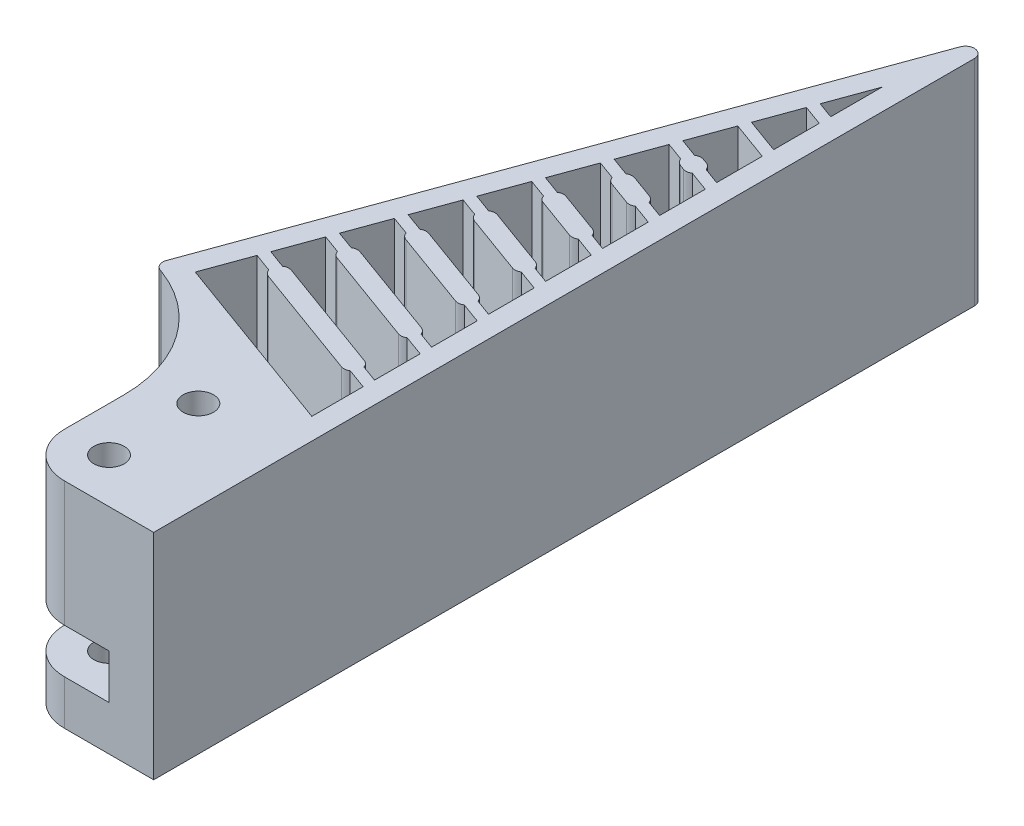
from build123d import *

# Parameters (mm, degrees)
SKETCH_1_R          = 1.7
EXTRUDE_1_DEPTH     = 24
CUT_EXTRUDE_START   = -5
SKETCH_2_R          = 1.7
CUT_EXTRUDE_1_DEPTH = 5
FILLET_1_R          = 1
FILLET_2_R          = 15


with BuildPart() as part:
    # 草图1 → 凸台-拉伸1 (new body)
    with BuildSketch(Plane(origin=(0, 0, 0), x_dir=(1, 0, 0), z_dir=(0, 1, 0))):
        with BuildLine():
            Line((-5, 17.140740034), (-5, 0))
            ThreePointArc((-5, 0), (-3.535533906, -3.535533906), (0, -5))
            Line((0, -5), (10, -5))
            Line((10, -5), (10, 92.570484452))
            Line((10, 92.570484452), (-15.997319233, 21.143436891))
            Line((-15.997319233, 21.143436891), (-5, 17.140740034))
        make_face()
        with Locations(Location((0, 0, 0), (0, 0, 270))):
            Circle(SKETCH_1_R, mode=Mode.SUBTRACT)
        with Locations(Location((0, 10, 0), (0, 0, 270))):
            Circle(SKETCH_1_R, mode=Mode.SUBTRACT)
        with BuildLine():
            Line((7.6, 15.108741736), (-12.9212086, 22.577850837))
            Line((-12.9212086, 22.577850837), (-11.074299826, 27.65219099))
            Line((-11.074299826, 27.65219099), (-9.00697606, 26.899746674))
            ThreePointArc((-9.00697606, 26.899746674), (-8.776165309, 26.502415559), (-8.392030021, 26.250253511))
            Line((-8.392030021, 26.250253511), (4.438901994, 21.58017618))
            ThreePointArc((4.438901994, 21.58017618), (4.895253337, 21.526426111), (5.327464148, 21.682437114))
            Line((5.327464148, 21.682437114), (7.6, 20.855301707))
            Line((7.6, 20.855301707), (7.6, 15.108741736))
        make_face(mode=Mode.SUBTRACT)
        with BuildLine():
            ThreePointArc((5.73788832, 22.810068259), (5.507077569, 23.207399374), (5.122942281, 23.459561422))
            Line((5.122942281, 23.459561422), (-7.707989734, 28.129638753))
            ThreePointArc((-7.707989734, 28.129638753), (-8.164341077, 28.183388821), (-8.596551888, 28.027377819))
            Line((-8.596551888, 28.027377819), (-10.663875654, 28.779822134))
            Line((-10.663875654, 28.779822134), (-9.022178966, 33.290346714))
            Line((-9.022178966, 33.290346714), (-6.9548552, 32.537902399))
            ThreePointArc((-6.9548552, 32.537902399), (-6.724044449, 32.140571284), (-6.339909161, 31.888409236))
            Line((-6.339909161, 31.888409236), (4.438901994, 27.965242815))
            ThreePointArc((4.438901994, 27.965242815), (4.895253337, 27.911492746), (5.327464148, 28.067503748))
            Line((5.327464148, 28.067503748), (7.6, 27.240368342))
            Line((7.6, 27.240368342), (7.6, 22.132315034))
            Line((7.6, 22.132315034), (5.73788832, 22.810068259))
        make_face(mode=Mode.SUBTRACT)
        with BuildLine():
            ThreePointArc((5.73788832, 29.195134893), (5.507077569, 29.592466009), (5.122942281, 29.844628056))
            Line((5.122942281, 29.844628056), (-5.655868874, 33.767794478))
            ThreePointArc((-5.655868874, 33.767794478), (-6.112220217, 33.821544546), (-6.544431028, 33.665533544))
            Line((-6.544431028, 33.665533544), (-8.611754794, 34.417977859))
            Line((-8.611754794, 34.417977859), (-6.970058106, 38.928502439))
            Line((-6.970058106, 38.928502439), (-4.90273434, 38.176058124))
            ThreePointArc((-4.90273434, 38.176058124), (-4.671923589, 37.778727008), (-4.287788301, 37.526564961))
            Line((-4.287788301, 37.526564961), (4.438901994, 34.35030945))
            ThreePointArc((4.438901994, 34.35030945), (4.895253337, 34.296559381), (5.327464148, 34.452570383))
            Line((5.327464148, 34.452570383), (7.6, 33.625434977))
            Line((7.6, 33.625434977), (7.6, 28.517381669))
            Line((7.6, 28.517381669), (5.73788832, 29.195134893))
        make_face(mode=Mode.SUBTRACT)
        with BuildLine():
            ThreePointArc((5.73788832, 35.580201528), (5.507077569, 35.977532644), (5.122942281, 36.229694691))
            Line((5.122942281, 36.229694691), (-3.603748014, 39.405950202))
            ThreePointArc((-3.603748014, 39.405950202), (-4.060099357, 39.459700271), (-4.492310168, 39.303689269))
            Line((-4.492310168, 39.303689269), (-6.559633934, 40.056133584))
            Line((-6.559633934, 40.056133584), (-4.917937246, 44.566658164))
            Line((-4.917937246, 44.566658164), (-2.85061348, 43.814213848))
            ThreePointArc((-2.85061348, 43.814213848), (-2.619802729, 43.416882733), (-2.235667441, 43.164720685))
            Line((-2.235667441, 43.164720685), (4.438901994, 40.735376085))
            ThreePointArc((4.438901994, 40.735376085), (4.895253337, 40.681626016), (5.327464148, 40.837637018))
            Line((5.327464148, 40.837637018), (7.6, 40.010501612))
            Line((7.6, 40.010501612), (7.6, 34.902448304))
            Line((7.6, 34.902448304), (5.73788832, 35.580201528))
        make_face(mode=Mode.SUBTRACT)
        with BuildLine():
            ThreePointArc((5.73788832, 41.965268163), (5.507077569, 42.362599278), (5.122942281, 42.614761326))
            Line((5.122942281, 42.614761326), (-1.551627154, 45.044105927))
            ThreePointArc((-1.551627154, 45.044105927), (-2.007978497, 45.097855995), (-2.440189308, 44.941844993))
            Line((-2.440189308, 44.941844993), (-4.507513074, 45.694289309))
            Line((-4.507513074, 45.694289309), (-2.865816386, 50.204813888))
            Line((-2.865816386, 50.204813888), (-0.79849262, 49.452369573))
            ThreePointArc((-0.79849262, 49.452369573), (-0.567681869, 49.055038458), (-0.183546581, 48.80287641))
            Line((-0.183546581, 48.80287641), (4.438901994, 47.120442719))
            ThreePointArc((4.438901994, 47.120442719), (4.895253337, 47.066692651), (5.327464148, 47.222703653))
            Line((5.327464148, 47.222703653), (7.6, 46.395568247))
            Line((7.6, 46.395568247), (7.6, 41.287514939))
            Line((7.6, 41.287514939), (5.73788832, 41.965268163))
        make_face(mode=Mode.SUBTRACT)
        with BuildLine():
            ThreePointArc((5.73788832, 48.350334798), (5.507077569, 48.747665913), (5.122942281, 48.999827961))
            Line((5.122942281, 48.999827961), (0.500493706, 50.682261652))
            ThreePointArc((0.500493706, 50.682261652), (0.044142363, 50.73601172), (-0.388068448, 50.580000718))
            Line((-0.388068448, 50.580000718), (-2.455392214, 51.332445033))
            Line((-2.455392214, 51.332445033), (-0.813695526, 55.842969613))
            Line((-0.813695526, 55.842969613), (1.25362824, 55.090525298))
            ThreePointArc((1.25362824, 55.090525298), (1.484438991, 54.693194182), (1.868574279, 54.441032135))
            Line((1.868574279, 54.441032135), (4.438901994, 53.505509354))
            ThreePointArc((4.438901994, 53.505509354), (4.895253337, 53.451759286), (5.327464148, 53.607770288))
            Line((5.327464148, 53.607770288), (7.6, 52.780634882))
            Line((7.6, 52.780634882), (7.6, 47.672581574))
            Line((7.6, 47.672581574), (5.73788832, 48.350334798))
        make_face(mode=Mode.SUBTRACT)
        with BuildLine():
            ThreePointArc((5.73788832, 54.735401433), (5.507077569, 55.132732548), (5.122942281, 55.384894596))
            Line((5.122942281, 55.384894596), (2.552614566, 56.320417376))
            ThreePointArc((2.552614566, 56.320417376), (2.096263223, 56.374167445), (1.664052412, 56.218156443))
            Line((1.664052412, 56.218156443), (-0.403271354, 56.970600758))
            Line((-0.403271354, 56.970600758), (1.238425334, 61.481125338))
            Line((1.238425334, 61.481125338), (3.3057491, 60.728681023))
            ThreePointArc((3.3057491, 60.728681023), (3.536559851, 60.331349907), (3.920695139, 60.07918786))
            Line((3.920695139, 60.07918786), (4.438901994, 59.890575989))
            ThreePointArc((4.438901994, 59.890575989), (4.895253337, 59.836825921), (5.327464148, 59.992836923))
            Line((5.327464148, 59.992836923), (7.6, 59.165701516))
            Line((7.6, 59.165701516), (7.6, 54.057648209))
            Line((7.6, 54.057648209), (5.73788832, 54.735401433))
        make_face(mode=Mode.SUBTRACT)
        with BuildLine():
            ThreePointArc((5.73788832, 61.120468068), (5.507077569, 61.517799183), (5.122942281, 61.769961231))
            Line((5.122942281, 61.769961231), (4.604735426, 61.958573101))
            ThreePointArc((4.604735426, 61.958573101), (4.148384083, 62.01232317), (3.716173272, 61.856312167))
            Line((3.716173272, 61.856312167), (1.648849506, 62.608756483))
            Line((1.648849506, 62.608756483), (3.290546194, 67.119281063))
            Line((3.290546194, 67.119281063), (7.6, 65.550768151))
            Line((7.6, 65.550768151), (7.6, 60.442714843))
            Line((7.6, 60.442714843), (5.73788832, 61.120468068))
        make_face(mode=Mode.SUBTRACT)
        Polygon((3.700970366, 68.246912207), (5.342667054, 72.757436787), (7.6, 71.935834786), (7.6, 66.827781478), align=None, mode=Mode.SUBTRACT)
        Polygon((5.753091226, 73.885067932), (7.6, 78.959408084), (7.6, 73.212848113), align=None, mode=Mode.SUBTRACT)
    extrude(amount=EXTRUDE_1_DEPTH)

    # 草图2 → 切除-拉伸1 (cut)
    with BuildSketch(Plane.XZ.offset(CUT_EXTRUDE_START)):
        with BuildLine():
            Line((-5, 5), (-5, -15))
            Line((-5, -15), (0.2, -15))
            ThreePointArc((0.2, -15), (3.59411255, -13.59411255), (5, -10.2))
            Line((5, -10.2), (5, 5))
            Line((5, 5), (-5, 5))
        make_face()
        with Locations(Location((0, -10, 0), (0, 0, 270))):
            Circle(SKETCH_2_R, mode=Mode.SUBTRACT)
        with Locations(Location((0, 0, 0), (0, 0, 270))):
            Circle(SKETCH_2_R, mode=Mode.SUBTRACT)
    extrude(amount=-CUT_EXTRUDE_1_DEPTH, mode=Mode.SUBTRACT)

    # 圆角1
    fillet_1_edges = [part.edges().sort_by_distance(p)[0] for p in [
        (-15.997319233, 12, -21.143436891),
        (10, 12, -92.570484452),
    ]]
    fillet(fillet_1_edges, radius=FILLET_1_R)

    # 圆角2
    # the kernel refuses this fillet: 15 mm, written as the material it adds along each edge
    with BuildSketch(Plane(origin=(-5, 0, -17.140740034), x_dir=(-0.9396926207859102, 0, -0.34202014332566355), z_dir=(0, 1, 0))) as fillet_2_piece_1_section:
        with BuildLine():
            CenterArc((FILLET_2_R * 0.70020753821, FILLET_2_R), FILLET_2_R, 200, 70)
            Line((-FILLET_2_R * 0.239485082576, FILLET_2_R * 0.657979856674), (0, 0))
            Line((0, 0), (FILLET_2_R * 0.70020753821, 0))
        make_face()
    fillet_2_piece_1 = extrude(amount=24, mode=Mode.PRIVATE)
    fillet_2_piece_1 = split(fillet_2_piece_1, bisect_by=Plane(origin=(-8.067749686, 5, -17.400247016), z_dir=(0, -1, 0)), keep=Keep.TOP, mode=Mode.PRIVATE)
    fillet_2_piece_1 = split(fillet_2_piece_1, bisect_by=Plane(origin=(-8.067749686, 2.5, -15), z_dir=(0, 0, -1)), keep=Keep.TOP, mode=Mode.PRIVATE)
    add(fillet_2_piece_1)
    with BuildSketch(Plane(origin=(-5, 0, -17.140740034), x_dir=(-0.9396926207859102, 0, -0.34202014332566355), z_dir=(0, 1, 0))) as fillet_2_piece_2_section:
        with BuildLine():
            CenterArc((FILLET_2_R * 0.70020753821, FILLET_2_R), FILLET_2_R, 200, 70)
            Line((-FILLET_2_R * 0.239485082576, FILLET_2_R * 0.657979856674), (0, 0))
            Line((0, 0), (FILLET_2_R * 0.70020753821, 0))
        make_face()
    fillet_2_piece_2 = extrude(amount=24, mode=Mode.PRIVATE)
    fillet_2_piece_2 = split(fillet_2_piece_2, bisect_by=Plane(origin=(-5.50966696, 5, -12.375604979), z_dir=(0, -1, 0)), keep=Keep.TOP, mode=Mode.PRIVATE)
    fillet_2_piece_2 = split(fillet_2_piece_2, bisect_by=Plane(origin=(-5.50966696, 2.5, -15), z_dir=(0, 0, 1)), keep=Keep.TOP, mode=Mode.PRIVATE)
    add(fillet_2_piece_2)
    with BuildSketch(Plane(origin=(-5, 0, -17.140740034), x_dir=(-0.9396926207859102, 0, -0.34202014332566355), z_dir=(0, 1, 0))) as fillet_2_piece_3_section:
        with BuildLine():
            CenterArc((FILLET_2_R * 0.70020753821, FILLET_2_R), FILLET_2_R, 200, 70)
            Line((-FILLET_2_R * 0.239485082576, FILLET_2_R * 0.657979856674), (0, 0))
            Line((0, 0), (FILLET_2_R * 0.70020753821, 0))
        make_face()
    fillet_2_piece_3 = extrude(amount=24, mode=Mode.PRIVATE)
    fillet_2_piece_3 = split(fillet_2_piece_3, bisect_by=Plane(origin=(-8.067749686, 5, -17.400247016), z_dir=(0, 1, 0)), keep=Keep.TOP, mode=Mode.PRIVATE)
    fillet_2_piece_3 = split(fillet_2_piece_3, bisect_by=Plane(origin=(-8.067749686, 7.5, -15), z_dir=(0, 0, -1)), keep=Keep.TOP, mode=Mode.PRIVATE)
    fillet_2_piece_3 = split(fillet_2_piece_3, bisect_by=Plane(origin=(-8.067749686, 10, -17.400247016), z_dir=(0, -1, 0)), keep=Keep.TOP, mode=Mode.PRIVATE)
    add(fillet_2_piece_3)
    with BuildSketch(Plane(origin=(-5, 0, -17.140740034), x_dir=(-0.9396926207859102, 0, -0.34202014332566355), z_dir=(0, 1, 0))) as fillet_2_piece_4_section:
        with BuildLine():
            CenterArc((FILLET_2_R * 0.70020753821, FILLET_2_R), FILLET_2_R, 200, 70)
            Line((-FILLET_2_R * 0.239485082576, FILLET_2_R * 0.657979856674), (0, 0))
            Line((0, 0), (FILLET_2_R * 0.70020753821, 0))
        make_face()
    fillet_2_piece_4 = extrude(amount=24, mode=Mode.PRIVATE)
    fillet_2_piece_4 = split(fillet_2_piece_4, bisect_by=Plane(origin=(-8.067749686, 17, -15), z_dir=(0, 0, -1)), keep=Keep.TOP, mode=Mode.PRIVATE)
    fillet_2_piece_4 = split(fillet_2_piece_4, bisect_by=Plane(origin=(-8.067749686, 10, -17.400247016), z_dir=(0, 1, 0)), keep=Keep.TOP, mode=Mode.PRIVATE)
    add(fillet_2_piece_4)
    with BuildSketch(Plane(origin=(-5, 0, -17.140740034), x_dir=(-0.9396926207859102, 0, -0.34202014332566355), z_dir=(0, 1, 0))) as fillet_2_piece_5_section:
        with BuildLine():
            CenterArc((FILLET_2_R * 0.70020753821, FILLET_2_R), FILLET_2_R, 200, 70)
            Line((-FILLET_2_R * 0.239485082576, FILLET_2_R * 0.657979856674), (0, 0))
            Line((0, 0), (FILLET_2_R * 0.70020753821, 0))
        make_face()
    fillet_2_piece_5 = extrude(amount=24, mode=Mode.PRIVATE)
    fillet_2_piece_5 = split(fillet_2_piece_5, bisect_by=Plane(origin=(-5.50966696, 17, -15), z_dir=(0, 0, 1)), keep=Keep.TOP, mode=Mode.PRIVATE)
    fillet_2_piece_5 = split(fillet_2_piece_5, bisect_by=Plane(origin=(-5.50966696, 10, -12.375604979), z_dir=(0, 1, 0)), keep=Keep.TOP, mode=Mode.PRIVATE)
    add(fillet_2_piece_5)


solid = part.part
